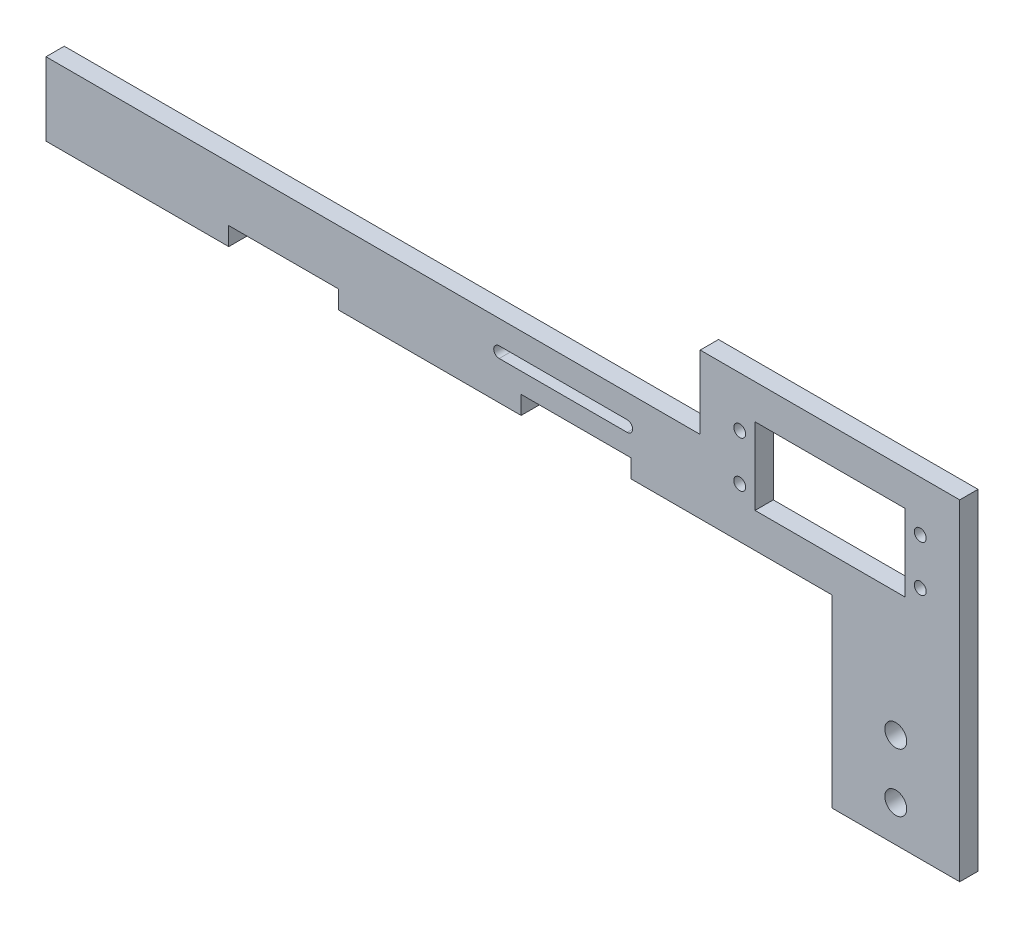
from build123d import *

# Parameters (mm, degrees)
ESBO_O1_R                = 3
ESBO_O1_R_2              = 1.625
ESBO_O1_W                = 41
ESBO_O1_H                = 21
RESSALTO_EXTRUS_O1_DEPTH = 5


with BuildPart() as part:
    # Esboço1 → Ressalto-extrusão1 (new body)
    with BuildSketch(Plane.XY):
        Polygon((160, -20), (215, -20), (215, -70.5), (250, -70.5), (250, -20), (250, 20), (179, 20), (179, 0), (0, 0), (0, -20), (50, -20), (50, -15), (80, -15), (80, -20), (130, -20), (130, -15), (160, -15), align=None)
        with Locations((232.5, -60.5)):
            Circle(ESBO_O1_R, mode=Mode.SUBTRACT)
        with Locations((232.5, -44.5)):
            Circle(ESBO_O1_R, mode=Mode.SUBTRACT)
        with BuildLine():
            ThreePointArc((124, -9.5), (122.5, -8), (124, -6.5))
            Line((124, -6.5), (159, -6.5))
            ThreePointArc((159, -6.5), (160.5, -8), (159, -9.5))
            Line((159, -9.5), (124, -9.5))
        make_face(mode=Mode.SUBTRACT)
        with Locations((189.8, -6.3)):
            Circle(ESBO_O1_R_2, mode=Mode.SUBTRACT)
        with Locations((239.2, -6.3)):
            Circle(ESBO_O1_R_2, mode=Mode.SUBTRACT)
        with Locations((214.5, 0)):
            Rectangle(ESBO_O1_W, ESBO_O1_H, mode=Mode.SUBTRACT)
        with Locations((189.8, 6.3)):
            Circle(ESBO_O1_R_2, mode=Mode.SUBTRACT)
        with Locations((239.2, 6.3)):
            Circle(ESBO_O1_R_2, mode=Mode.SUBTRACT)
    extrude(amount=RESSALTO_EXTRUS_O1_DEPTH)


solid = part.part
